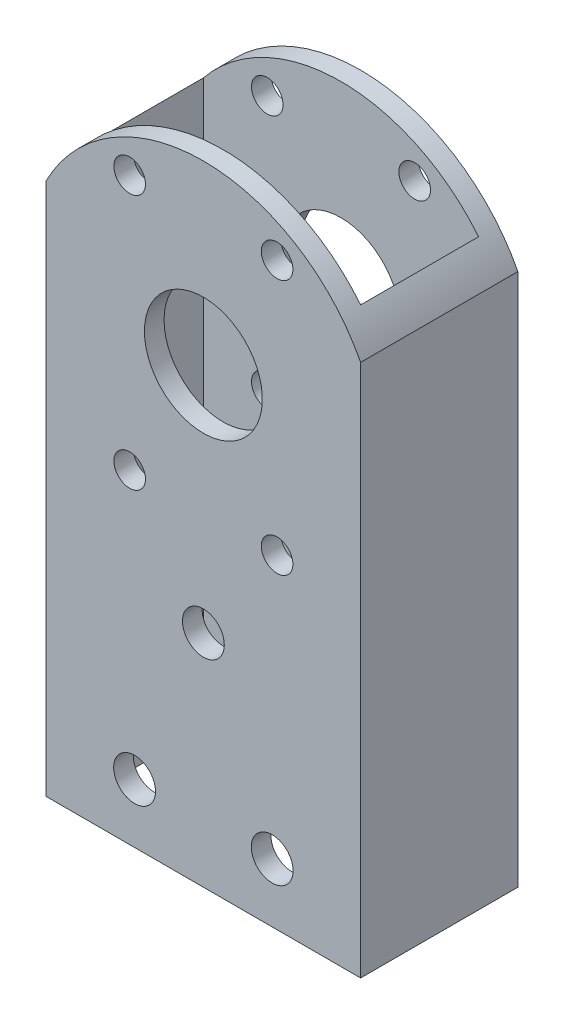
from build123d import *

# Parameters (mm, degrees)
SKETCH1_W               = 50.8
SKETCH1_H               = 25.4
SKETCH1_W_2             = 44.45
SKETCH1_H_2             = 19.05
EXTRUDE_THIN1_DEPTH     = 101.6
F_10_CLEARANCE_HOLE1_D  = 5.1054
CUT_EXTRUDE2_DEPTH      = 108.763073453
CUT_EXTRUDE2_DEPTH_BACK = 108.763073453
SKETCH7_R               = 9.525
F_1_4_CLEARANCE_HOLE2_D = 6.7564
CUT_EXTRUDE3_DEPTH      = 108.763073453
F_1_4_CLEARANCE_HOLE1_D = 6.7564


with BuildPart() as part:
    # Sketch1 → Extrude-Thin1 (new body)
    with BuildSketch(Plane(origin=(0, 0, 0), x_dir=(1, 0, 0), z_dir=(0, 1, 0))):
        Rectangle(SKETCH1_W, SKETCH1_H)
        Rectangle(SKETCH1_W_2, SKETCH1_H_2, mode=Mode.SUBTRACT)
    extrude(amount=EXTRUDE_THIN1_DEPTH)

    # #10 Clearance Hole1 (through all)
    with Locations(Plane(origin=(0, 0, -12.7), x_dir=(-1, 0, 0), z_dir=(0, 0, -1))):
        with Locations((-11.90625, 52.402770072), (-11.90625, 93.647229928), (11.90625, 93.647229928), (11.90625, 52.402770072)):
            Hole(F_10_CLEARANCE_HOLE1_D / 2)

    # Sketch7 → Cut-Extrude2 (cut, two sides: drawn at the far end of the back side and taken through both)
    with BuildSketch(Plane(origin=(0, 0, -12.7), x_dir=(-1, 0, 0), z_dir=(0, 0, -1)).offset(-CUT_EXTRUDE2_DEPTH_BACK)):
        with Locations((0, 73.025)):
            Circle(SKETCH7_R)
    extrude(amount=CUT_EXTRUDE2_DEPTH + CUT_EXTRUDE2_DEPTH_BACK, mode=Mode.SUBTRACT)

    # 1/4 Clearance Hole2 (through all)
    with Locations(Plane.XY.offset(12.7)):
        with Locations((-11.1125, 9.525), (11.1125, 9.525), (-109.171479686, 68.785430569)):
            Hole(F_1_4_CLEARANCE_HOLE2_D / 2)

    # Sketch10 → Cut-Extrude3 (cut, through all)
    with BuildSketch(Plane(origin=(0, 0, -12.7), x_dir=(-1, 0, 0), z_dir=(0, 0, -1))):
        with BuildLine():
            Line((25.4, 101.6), (0, 101.6))
            ThreePointArc((0, 101.6), (14.873790542, 97.423790542), (25.4, 86.115860361))
            Line((25.4, 86.115860361), (25.4, 101.6))
        make_face()
        with BuildLine():
            Line((-25.4, 101.6), (-25.4, 86.115860361))
            ThreePointArc((-25.4, 86.115860361), (-14.873790542, 97.423790542), (0, 101.6))
            Line((0, 101.6), (-25.4, 101.6))
        make_face()
    extrude(amount=-CUT_EXTRUDE3_DEPTH, mode=Mode.SUBTRACT)

    # 1/4 Clearance Hole1 (through all)
    with Locations(Plane.XY.offset(12.7)):
        with Locations((0, 35.56)):
            Hole(F_1_4_CLEARANCE_HOLE1_D / 2)


solid = part.part
